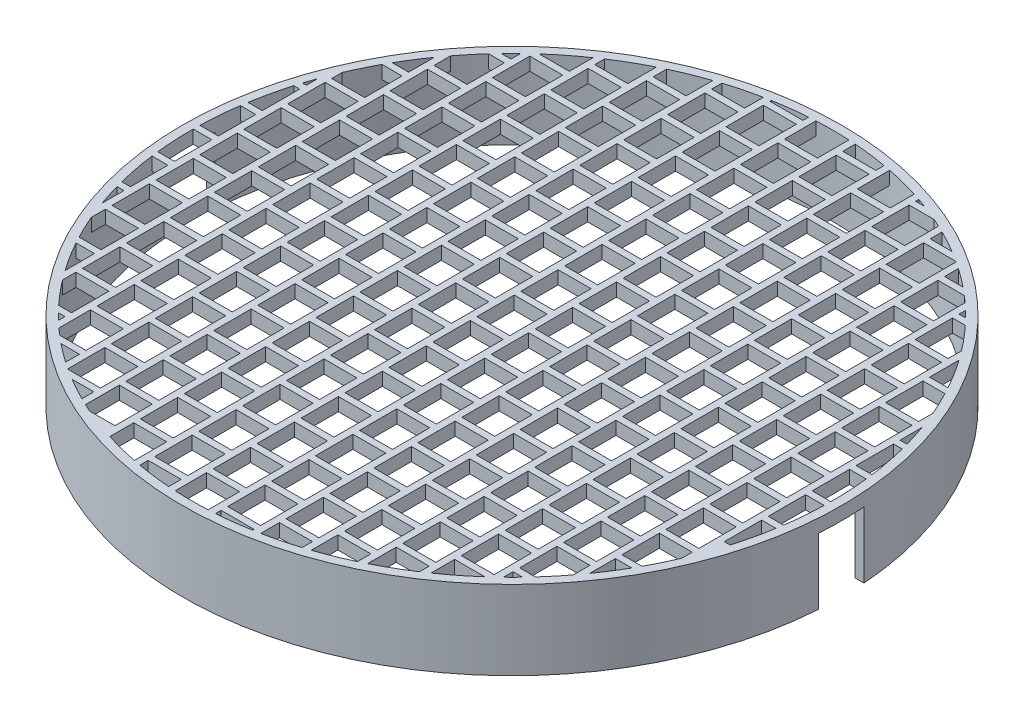
from build123d import *
from build123d.topology import SkipClean

# Parameters (mm, degrees)
BOSS_EXTRUDE1_DEPTH        = 15
BOSS_EXTRUDE1_DEPTH_BACK   = 3
BOSS_EXTRUDE1_2_DEPTH      = 15
BOSS_EXTRUDE1_2_DEPTH_BACK = 3
SKETCH2_R                  = 88.682492018
SKETCH2_W                  = 7.5
SKETCH2_H                  = 8.5
BOSS_EXTRUDE5_DEPTH        = 3
CUT_EXTRUDE1_DEPTH         = 127.701100157
CUT_EXTRUDE1_DEPTH_BACK    = 127.701100157
SKETCH3_R                  = 98.497493729
SKETCH3_R_2                = 75
BOSS_EXTRUDE6_START        = -3
BOSS_EXTRUDE6_DEPTH        = 3


with BuildPart() as part:
    # Sketch1 → Boss-Extrude1 (new, two sides: drawn at the far end of the back side and taken through both)
    with BuildSketch(Plane(origin=(0, 0, 0), x_dir=(1, 0, 0), z_dir=(0, 1, 0)).offset(-BOSS_EXTRUDE1_DEPTH_BACK)):
        with BuildLine():
            Line((72.8095066, 5.27027027), (74.814599185, 5.27027027))
            ThreePointArc((74.814599185, 5.27027027), (74.792407557, 5.57635829), (74.768963641, 5.882352941))
            ThreePointArc((74.768963641, 5.882352941), (0, 75), (-74.768963641, 5.882352941))
            ThreePointArc((-74.768963641, 5.882352941), (-74.792407557, 5.57635829), (-74.814599185, 5.27027027))
            Line((-74.814599185, 5.27027027), (-72.8095066, 5.27027027))
            ThreePointArc((-72.8095066, 5.27027027), (-72.785299957, 5.594650136), (-72.759648149, 5.918918919))
            ThreePointArc((-72.759648149, 5.918918919), (0, 73), (72.759648149, 5.918918919))
            ThreePointArc((72.759648149, 5.918918919), (72.785299957, 5.594650136), (72.8095066, 5.27027027))
        make_face()
    extrude(amount=BOSS_EXTRUDE1_DEPTH + BOSS_EXTRUDE1_DEPTH_BACK)



with BuildPart() as body_2:
    # Sketch1 → Boss-Extrude1 2 (new, two sides: drawn at the far end of the back side and taken through both)
    with BuildSketch(Plane(origin=(0, 0, 0), x_dir=(1, 0, 0), z_dir=(0, 1, 0)).offset(-BOSS_EXTRUDE1_2_DEPTH_BACK)):
        with BuildLine():
            Line((-74.824366839, -5.12972973), (-72.819543207, -5.12972973))
            ThreePointArc((-72.819543207, -5.12972973), (-72.790665225, -5.524405497), (-72.759648149, -5.918918919))
            ThreePointArc((-72.759648149, -5.918918919), (0, -73), (72.759648149, -5.918918919))
            ThreePointArc((72.759648149, -5.918918919), (72.790665225, -5.524405497), (72.819543207, -5.12972973))
            Line((72.819543207, -5.12972973), (74.824366839, -5.12972973))
            ThreePointArc((74.824366839, -5.12972973), (74.79761187, -5.50611102), (74.768963641, -5.882352941))
            ThreePointArc((74.768963641, -5.882352941), (0, -75), (-74.768963641, -5.882352941))
            ThreePointArc((-74.768963641, -5.882352941), (-74.79761187, -5.50611102), (-74.824366839, -5.12972973))
        make_face()
    extrude(amount=BOSS_EXTRUDE1_2_DEPTH + BOSS_EXTRUDE1_2_DEPTH_BACK)


with BuildPart() as part_1:
    add(part.part)

    add(body_2.part)  # Boss-Extrude5 merges body 2
    # Sketch2 → Boss-Extrude5 (add)
    with BuildSketch(Plane(origin=(0, 15, 0), x_dir=(1, 0, 0), z_dir=(0, 1, 0))):
        with Locations(Location((0, 0, 0), (0, 0, 270))):
            Circle(SKETCH2_R)
        Rectangle(SKETCH2_W, SKETCH2_H, mode=Mode.SUBTRACT)
        with Locations((9.06307787, 14.226182617)):
            Rectangle(SKETCH2_W, SKETCH2_H, mode=Mode.SUBTRACT)
        with Locations((18.126155741, 18.452365235)):
            Rectangle(SKETCH2_W, SKETCH2_H, mode=Mode.SUBTRACT)
        with Locations((27.189233611, 22.678547852)):
            Rectangle(SKETCH2_W, SKETCH2_H, mode=Mode.SUBTRACT)
        with Locations((36.252311481, 26.90473047)):
            Rectangle(SKETCH2_W, SKETCH2_H, mode=Mode.SUBTRACT)
        with Locations((45.315389352, 31.130913087)):
            Rectangle(SKETCH2_W, SKETCH2_H, mode=Mode.SUBTRACT)
        with Locations((54.378467222, 35.357095704)):
            Rectangle(SKETCH2_W, SKETCH2_H, mode=Mode.SUBTRACT)
        with Locations((63.441545093, 39.583278322)):
            Rectangle(SKETCH2_W, SKETCH2_H, mode=Mode.SUBTRACT)
        with Locations((9.06307787, 24.226182617)):
            Rectangle(SKETCH2_W, SKETCH2_H, mode=Mode.SUBTRACT)
        with Locations((18.126155741, 28.452365235)):
            Rectangle(SKETCH2_W, SKETCH2_H, mode=Mode.SUBTRACT)
        with Locations((27.189233611, 32.678547852)):
            Rectangle(SKETCH2_W, SKETCH2_H, mode=Mode.SUBTRACT)
        with Locations((36.252311481, 36.90473047)):
            Rectangle(SKETCH2_W, SKETCH2_H, mode=Mode.SUBTRACT)
        with Locations((45.315389352, 41.130913087)):
            Rectangle(SKETCH2_W, SKETCH2_H, mode=Mode.SUBTRACT)
        with Locations((54.378467222, 45.357095704)):
            Rectangle(SKETCH2_W, SKETCH2_H, mode=Mode.SUBTRACT)
        with Locations((9.06307787, 34.226182617)):
            Rectangle(SKETCH2_W, SKETCH2_H, mode=Mode.SUBTRACT)
        with Locations((18.126155741, 38.452365235)):
            Rectangle(SKETCH2_W, SKETCH2_H, mode=Mode.SUBTRACT)
        with Locations((27.189233611, 42.678547852)):
            Rectangle(SKETCH2_W, SKETCH2_H, mode=Mode.SUBTRACT)
        with Locations((36.252311481, 46.90473047)):
            Rectangle(SKETCH2_W, SKETCH2_H, mode=Mode.SUBTRACT)
        with Locations((45.315389352, 51.130913087)):
            Rectangle(SKETCH2_W, SKETCH2_H, mode=Mode.SUBTRACT)
        with Locations((54.378467222, 55.357095704)):
            Rectangle(SKETCH2_W, SKETCH2_H, mode=Mode.SUBTRACT)
        with Locations((9.06307787, 44.226182617)):
            Rectangle(SKETCH2_W, SKETCH2_H, mode=Mode.SUBTRACT)
        with Locations((18.126155741, 48.452365235)):
            Rectangle(SKETCH2_W, SKETCH2_H, mode=Mode.SUBTRACT)
        with Locations((27.189233611, 52.678547852)):
            Rectangle(SKETCH2_W, SKETCH2_H, mode=Mode.SUBTRACT)
        with Locations((36.252311481, 56.90473047)):
            Rectangle(SKETCH2_W, SKETCH2_H, mode=Mode.SUBTRACT)
        with Locations((45.315389352, 61.130913087)):
            Rectangle(SKETCH2_W, SKETCH2_H, mode=Mode.SUBTRACT)
        with Locations((9.06307787, 54.226182617)):
            Rectangle(SKETCH2_W, SKETCH2_H, mode=Mode.SUBTRACT)
        with Locations((18.126155741, 58.452365235)):
            Rectangle(SKETCH2_W, SKETCH2_H, mode=Mode.SUBTRACT)
        with Locations((27.189233611, 62.678547852)):
            Rectangle(SKETCH2_W, SKETCH2_H, mode=Mode.SUBTRACT)
        with Locations((36.252311481, 66.90473047)):
            Rectangle(SKETCH2_W, SKETCH2_H, mode=Mode.SUBTRACT)
        with Locations((9.06307787, 64.226182617)):
            Rectangle(SKETCH2_W, SKETCH2_H, mode=Mode.SUBTRACT)
        with Locations((18.126155741, 68.452365235)):
            Rectangle(SKETCH2_W, SKETCH2_H, mode=Mode.SUBTRACT)
        with Locations((27.189233611, 72.678547852)):
            Rectangle(SKETCH2_W, SKETCH2_H, mode=Mode.SUBTRACT)
        with Locations((9.06307787, 74.226182617)):
            Rectangle(SKETCH2_W, SKETCH2_H, mode=Mode.SUBTRACT)
        with Locations((9.06307787, 4.226182617)):
            Rectangle(SKETCH2_W, SKETCH2_H, mode=Mode.SUBTRACT)
        with Locations((18.126155741, 8.452365235)):
            Rectangle(SKETCH2_W, SKETCH2_H, mode=Mode.SUBTRACT)
        with Locations((27.189233611, 12.678547852)):
            Rectangle(SKETCH2_W, SKETCH2_H, mode=Mode.SUBTRACT)
        with Locations((36.252311481, 16.90473047)):
            Rectangle(SKETCH2_W, SKETCH2_H, mode=Mode.SUBTRACT)
        with Locations((45.315389352, 21.130913087)):
            Rectangle(SKETCH2_W, SKETCH2_H, mode=Mode.SUBTRACT)
        with Locations((54.378467222, 25.357095704)):
            Rectangle(SKETCH2_W, SKETCH2_H, mode=Mode.SUBTRACT)
        with Locations((63.441545093, 29.583278322)):
            Rectangle(SKETCH2_W, SKETCH2_H, mode=Mode.SUBTRACT)
        with Locations((9.06307787, -5.773817383)):
            Rectangle(SKETCH2_W, SKETCH2_H, mode=Mode.SUBTRACT)
        with Locations((18.126155741, -1.547634765)):
            Rectangle(SKETCH2_W, SKETCH2_H, mode=Mode.SUBTRACT)
        with Locations((27.189233611, 2.678547852)):
            Rectangle(SKETCH2_W, SKETCH2_H, mode=Mode.SUBTRACT)
        with Locations((36.252311481, 6.90473047)):
            Rectangle(SKETCH2_W, SKETCH2_H, mode=Mode.SUBTRACT)
        with Locations((45.315389352, 11.130913087)):
            Rectangle(SKETCH2_W, SKETCH2_H, mode=Mode.SUBTRACT)
        with Locations((54.378467222, 15.357095704)):
            Rectangle(SKETCH2_W, SKETCH2_H, mode=Mode.SUBTRACT)
        with Locations((63.441545093, 19.583278322)):
            Rectangle(SKETCH2_W, SKETCH2_H, mode=Mode.SUBTRACT)
        with Locations((72.504622963, 23.809460939)):
            Rectangle(SKETCH2_W, SKETCH2_H, mode=Mode.SUBTRACT)
        with Locations((9.06307787, -15.773817383)):
            Rectangle(SKETCH2_W, SKETCH2_H, mode=Mode.SUBTRACT)
        with Locations((18.126155741, -11.547634765)):
            Rectangle(SKETCH2_W, SKETCH2_H, mode=Mode.SUBTRACT)
        with Locations((27.189233611, -7.321452148)):
            Rectangle(SKETCH2_W, SKETCH2_H, mode=Mode.SUBTRACT)
        with Locations((36.252311481, -3.09526953)):
            Rectangle(SKETCH2_W, SKETCH2_H, mode=Mode.SUBTRACT)
        with Locations((45.315389352, 1.130913087)):
            Rectangle(SKETCH2_W, SKETCH2_H, mode=Mode.SUBTRACT)
        with Locations((54.378467222, 5.357095704)):
            Rectangle(SKETCH2_W, SKETCH2_H, mode=Mode.SUBTRACT)
        with Locations((63.441545093, 9.583278322)):
            Rectangle(SKETCH2_W, SKETCH2_H, mode=Mode.SUBTRACT)
        with Locations((72.504622963, 13.809460939)):
            Rectangle(SKETCH2_W, SKETCH2_H, mode=Mode.SUBTRACT)
        with Locations((9.06307787, -25.773817383)):
            Rectangle(SKETCH2_W, SKETCH2_H, mode=Mode.SUBTRACT)
        with Locations((18.126155741, -21.547634765)):
            Rectangle(SKETCH2_W, SKETCH2_H, mode=Mode.SUBTRACT)
        with Locations((27.189233611, -17.321452148)):
            Rectangle(SKETCH2_W, SKETCH2_H, mode=Mode.SUBTRACT)
        with Locations((36.252311481, -13.09526953)):
            Rectangle(SKETCH2_W, SKETCH2_H, mode=Mode.SUBTRACT)
        with Locations((45.315389352, -8.869086913)):
            Rectangle(SKETCH2_W, SKETCH2_H, mode=Mode.SUBTRACT)
        with Locations((54.378467222, -4.642904296)):
            Rectangle(SKETCH2_W, SKETCH2_H, mode=Mode.SUBTRACT)
        with Locations((63.441545093, -0.416721678)):
            Rectangle(SKETCH2_W, SKETCH2_H, mode=Mode.SUBTRACT)
        with Locations((72.504622963, 3.809460939)):
            Rectangle(SKETCH2_W, SKETCH2_H, mode=Mode.SUBTRACT)
        with Locations((9.06307787, -35.773817383)):
            Rectangle(SKETCH2_W, SKETCH2_H, mode=Mode.SUBTRACT)
        with Locations((18.126155741, -31.547634765)):
            Rectangle(SKETCH2_W, SKETCH2_H, mode=Mode.SUBTRACT)
        with Locations((27.189233611, -27.321452148)):
            Rectangle(SKETCH2_W, SKETCH2_H, mode=Mode.SUBTRACT)
        with Locations((36.252311481, -23.09526953)):
            Rectangle(SKETCH2_W, SKETCH2_H, mode=Mode.SUBTRACT)
        with Locations((45.315389352, -18.869086913)):
            Rectangle(SKETCH2_W, SKETCH2_H, mode=Mode.SUBTRACT)
        with Locations((54.378467222, -14.642904296)):
            Rectangle(SKETCH2_W, SKETCH2_H, mode=Mode.SUBTRACT)
        with Locations((63.441545093, -10.416721678)):
            Rectangle(SKETCH2_W, SKETCH2_H, mode=Mode.SUBTRACT)
        with Locations((72.504622963, -6.190539061)):
            Rectangle(SKETCH2_W, SKETCH2_H, mode=Mode.SUBTRACT)
        with Locations((9.06307787, -45.773817383)):
            Rectangle(SKETCH2_W, SKETCH2_H, mode=Mode.SUBTRACT)
        with Locations((18.126155741, -41.547634765)):
            Rectangle(SKETCH2_W, SKETCH2_H, mode=Mode.SUBTRACT)
        with Locations((27.189233611, -37.321452148)):
            Rectangle(SKETCH2_W, SKETCH2_H, mode=Mode.SUBTRACT)
        with Locations((36.252311481, -33.09526953)):
            Rectangle(SKETCH2_W, SKETCH2_H, mode=Mode.SUBTRACT)
        with Locations((45.315389352, -28.869086913)):
            Rectangle(SKETCH2_W, SKETCH2_H, mode=Mode.SUBTRACT)
        with Locations((54.378467222, -24.642904296)):
            Rectangle(SKETCH2_W, SKETCH2_H, mode=Mode.SUBTRACT)
        with Locations((63.441545093, -20.416721678)):
            Rectangle(SKETCH2_W, SKETCH2_H, mode=Mode.SUBTRACT)
        with Locations((72.504622963, -16.190539061)):
            Rectangle(SKETCH2_W, SKETCH2_H, mode=Mode.SUBTRACT)
        with Locations((9.06307787, -55.773817383)):
            Rectangle(SKETCH2_W, SKETCH2_H, mode=Mode.SUBTRACT)
        with Locations((18.126155741, -51.547634765)):
            Rectangle(SKETCH2_W, SKETCH2_H, mode=Mode.SUBTRACT)
        with Locations((27.189233611, -47.321452148)):
            Rectangle(SKETCH2_W, SKETCH2_H, mode=Mode.SUBTRACT)
        with Locations((36.252311481, -43.09526953)):
            Rectangle(SKETCH2_W, SKETCH2_H, mode=Mode.SUBTRACT)
        with Locations((45.315389352, -38.869086913)):
            Rectangle(SKETCH2_W, SKETCH2_H, mode=Mode.SUBTRACT)
        with Locations((54.378467222, -34.642904296)):
            Rectangle(SKETCH2_W, SKETCH2_H, mode=Mode.SUBTRACT)
        with Locations((63.441545093, -30.416721678)):
            Rectangle(SKETCH2_W, SKETCH2_H, mode=Mode.SUBTRACT)
        with Locations((9.06307787, -65.773817383)):
            Rectangle(SKETCH2_W, SKETCH2_H, mode=Mode.SUBTRACT)
        with Locations((18.126155741, -61.547634765)):
            Rectangle(SKETCH2_W, SKETCH2_H, mode=Mode.SUBTRACT)
        with Locations((27.189233611, -57.321452148)):
            Rectangle(SKETCH2_W, SKETCH2_H, mode=Mode.SUBTRACT)
        with Locations((36.252311481, -53.09526953)):
            Rectangle(SKETCH2_W, SKETCH2_H, mode=Mode.SUBTRACT)
        with Locations((45.315389352, -48.869086913)):
            Rectangle(SKETCH2_W, SKETCH2_H, mode=Mode.SUBTRACT)
        with Locations((54.378467222, -44.642904296)):
            Rectangle(SKETCH2_W, SKETCH2_H, mode=Mode.SUBTRACT)
        with Locations((63.441545093, -40.416721678)):
            Rectangle(SKETCH2_W, SKETCH2_H, mode=Mode.SUBTRACT)
        with Locations((9.06307787, -75.773817383)):
            Rectangle(SKETCH2_W, SKETCH2_H, mode=Mode.SUBTRACT)
        with Locations((18.126155741, -71.547634765)):
            Rectangle(SKETCH2_W, SKETCH2_H, mode=Mode.SUBTRACT)
        with Locations((27.189233611, -67.321452148)):
            Rectangle(SKETCH2_W, SKETCH2_H, mode=Mode.SUBTRACT)
        with Locations((36.252311481, -63.09526953)):
            Rectangle(SKETCH2_W, SKETCH2_H, mode=Mode.SUBTRACT)
        with Locations((45.315389352, -58.869086913)):
            Rectangle(SKETCH2_W, SKETCH2_H, mode=Mode.SUBTRACT)
        with Locations((54.378467222, -54.642904296)):
            Rectangle(SKETCH2_W, SKETCH2_H, mode=Mode.SUBTRACT)
        with Locations((-9.06307787, 5.773817383)):
            Rectangle(SKETCH2_W, SKETCH2_H, mode=Mode.SUBTRACT)
        with Locations((-18.126155741, 1.547634765)):
            Rectangle(SKETCH2_W, SKETCH2_H, mode=Mode.SUBTRACT)
        with Locations((-27.189233611, -2.678547852)):
            Rectangle(SKETCH2_W, SKETCH2_H, mode=Mode.SUBTRACT)
        with Locations((-36.252311481, -6.90473047)):
            Rectangle(SKETCH2_W, SKETCH2_H, mode=Mode.SUBTRACT)
        with Locations((-45.315389352, -11.130913087)):
            Rectangle(SKETCH2_W, SKETCH2_H, mode=Mode.SUBTRACT)
        with Locations((-54.378467222, -15.357095704)):
            Rectangle(SKETCH2_W, SKETCH2_H, mode=Mode.SUBTRACT)
        with Locations((-63.441545093, -19.583278322)):
            Rectangle(SKETCH2_W, SKETCH2_H, mode=Mode.SUBTRACT)
        with Locations((-72.504622963, -23.809460939)):
            Rectangle(SKETCH2_W, SKETCH2_H, mode=Mode.SUBTRACT)
        with Locations((-9.06307787, 15.773817383)):
            Rectangle(SKETCH2_W, SKETCH2_H, mode=Mode.SUBTRACT)
        with Locations((-18.126155741, 11.547634765)):
            Rectangle(SKETCH2_W, SKETCH2_H, mode=Mode.SUBTRACT)
        with Locations((-27.189233611, 7.321452148)):
            Rectangle(SKETCH2_W, SKETCH2_H, mode=Mode.SUBTRACT)
        with Locations((-36.252311481, 3.09526953)):
            Rectangle(SKETCH2_W, SKETCH2_H, mode=Mode.SUBTRACT)
        with Locations((-45.315389352, -1.130913087)):
            Rectangle(SKETCH2_W, SKETCH2_H, mode=Mode.SUBTRACT)
        with Locations((-54.378467222, -5.357095704)):
            Rectangle(SKETCH2_W, SKETCH2_H, mode=Mode.SUBTRACT)
        with Locations((-63.441545093, -9.583278322)):
            Rectangle(SKETCH2_W, SKETCH2_H, mode=Mode.SUBTRACT)
        with Locations((-72.504622963, -13.809460939)):
            Rectangle(SKETCH2_W, SKETCH2_H, mode=Mode.SUBTRACT)
        with Locations((-9.06307787, 25.773817383)):
            Rectangle(SKETCH2_W, SKETCH2_H, mode=Mode.SUBTRACT)
        with Locations((-18.126155741, 21.547634765)):
            Rectangle(SKETCH2_W, SKETCH2_H, mode=Mode.SUBTRACT)
        with Locations((-27.189233611, 17.321452148)):
            Rectangle(SKETCH2_W, SKETCH2_H, mode=Mode.SUBTRACT)
        with Locations((-36.252311481, 13.09526953)):
            Rectangle(SKETCH2_W, SKETCH2_H, mode=Mode.SUBTRACT)
        with Locations((-45.315389352, 8.869086913)):
            Rectangle(SKETCH2_W, SKETCH2_H, mode=Mode.SUBTRACT)
        with Locations((-54.378467222, 4.642904296)):
            Rectangle(SKETCH2_W, SKETCH2_H, mode=Mode.SUBTRACT)
        with Locations((-63.441545093, 0.416721678)):
            Rectangle(SKETCH2_W, SKETCH2_H, mode=Mode.SUBTRACT)
        with Locations((-72.504622963, -3.809460939)):
            Rectangle(SKETCH2_W, SKETCH2_H, mode=Mode.SUBTRACT)
        with Locations((-9.06307787, 35.773817383)):
            Rectangle(SKETCH2_W, SKETCH2_H, mode=Mode.SUBTRACT)
        with Locations((-18.126155741, 31.547634765)):
            Rectangle(SKETCH2_W, SKETCH2_H, mode=Mode.SUBTRACT)
        with Locations((-27.189233611, 27.321452148)):
            Rectangle(SKETCH2_W, SKETCH2_H, mode=Mode.SUBTRACT)
        with Locations((-36.252311481, 23.09526953)):
            Rectangle(SKETCH2_W, SKETCH2_H, mode=Mode.SUBTRACT)
        with Locations((-45.315389352, 18.869086913)):
            Rectangle(SKETCH2_W, SKETCH2_H, mode=Mode.SUBTRACT)
        with Locations((-54.378467222, 14.642904296)):
            Rectangle(SKETCH2_W, SKETCH2_H, mode=Mode.SUBTRACT)
        with Locations((-63.441545093, 10.416721678)):
            Rectangle(SKETCH2_W, SKETCH2_H, mode=Mode.SUBTRACT)
        with Locations((-72.504622963, 6.190539061)):
            Rectangle(SKETCH2_W, SKETCH2_H, mode=Mode.SUBTRACT)
        with Locations((-9.06307787, 45.773817383)):
            Rectangle(SKETCH2_W, SKETCH2_H, mode=Mode.SUBTRACT)
        with Locations((-18.126155741, 41.547634765)):
            Rectangle(SKETCH2_W, SKETCH2_H, mode=Mode.SUBTRACT)
        with Locations((-27.189233611, 37.321452148)):
            Rectangle(SKETCH2_W, SKETCH2_H, mode=Mode.SUBTRACT)
        with Locations((-36.252311481, 33.09526953)):
            Rectangle(SKETCH2_W, SKETCH2_H, mode=Mode.SUBTRACT)
        with Locations((-45.315389352, 28.869086913)):
            Rectangle(SKETCH2_W, SKETCH2_H, mode=Mode.SUBTRACT)
        with Locations((-54.378467222, 24.642904296)):
            Rectangle(SKETCH2_W, SKETCH2_H, mode=Mode.SUBTRACT)
        with Locations((-63.441545093, 20.416721678)):
            Rectangle(SKETCH2_W, SKETCH2_H, mode=Mode.SUBTRACT)
        with Locations((-72.504622963, 16.190539061)):
            Rectangle(SKETCH2_W, SKETCH2_H, mode=Mode.SUBTRACT)
        with Locations((-9.06307787, 55.773817383)):
            Rectangle(SKETCH2_W, SKETCH2_H, mode=Mode.SUBTRACT)
        with Locations((-18.126155741, 51.547634765)):
            Rectangle(SKETCH2_W, SKETCH2_H, mode=Mode.SUBTRACT)
        with Locations((-27.189233611, 47.321452148)):
            Rectangle(SKETCH2_W, SKETCH2_H, mode=Mode.SUBTRACT)
        with Locations((-36.252311481, 43.09526953)):
            Rectangle(SKETCH2_W, SKETCH2_H, mode=Mode.SUBTRACT)
        with Locations((-45.315389352, 38.869086913)):
            Rectangle(SKETCH2_W, SKETCH2_H, mode=Mode.SUBTRACT)
        with Locations((-54.378467222, 34.642904296)):
            Rectangle(SKETCH2_W, SKETCH2_H, mode=Mode.SUBTRACT)
        with Locations((-63.441545093, 30.416721678)):
            Rectangle(SKETCH2_W, SKETCH2_H, mode=Mode.SUBTRACT)
        with Locations((-72.504622963, 26.190539061)):
            Rectangle(SKETCH2_W, SKETCH2_H, mode=Mode.SUBTRACT)
        with Locations((-9.06307787, 65.773817383)):
            Rectangle(SKETCH2_W, SKETCH2_H, mode=Mode.SUBTRACT)
        with Locations((-18.126155741, 61.547634765)):
            Rectangle(SKETCH2_W, SKETCH2_H, mode=Mode.SUBTRACT)
        with Locations((-27.189233611, 57.321452148)):
            Rectangle(SKETCH2_W, SKETCH2_H, mode=Mode.SUBTRACT)
        with Locations((-36.252311481, 53.09526953)):
            Rectangle(SKETCH2_W, SKETCH2_H, mode=Mode.SUBTRACT)
        with Locations((-45.315389352, 48.869086913)):
            Rectangle(SKETCH2_W, SKETCH2_H, mode=Mode.SUBTRACT)
        with Locations((-54.378467222, 44.642904296)):
            Rectangle(SKETCH2_W, SKETCH2_H, mode=Mode.SUBTRACT)
        with Locations((-63.441545093, 40.416721678)):
            Rectangle(SKETCH2_W, SKETCH2_H, mode=Mode.SUBTRACT)
        with Locations((-9.06307787, 75.773817383)):
            Rectangle(SKETCH2_W, SKETCH2_H, mode=Mode.SUBTRACT)
        with Locations((-18.126155741, 71.547634765)):
            Rectangle(SKETCH2_W, SKETCH2_H, mode=Mode.SUBTRACT)
        with Locations((-27.189233611, 67.321452148)):
            Rectangle(SKETCH2_W, SKETCH2_H, mode=Mode.SUBTRACT)
        with Locations((-36.252311481, 63.09526953)):
            Rectangle(SKETCH2_W, SKETCH2_H, mode=Mode.SUBTRACT)
        with Locations((-45.315389352, 58.869086913)):
            Rectangle(SKETCH2_W, SKETCH2_H, mode=Mode.SUBTRACT)
        with Locations((-54.378467222, 54.642904296)):
            Rectangle(SKETCH2_W, SKETCH2_H, mode=Mode.SUBTRACT)
        with Locations((0, 10)):
            Rectangle(SKETCH2_W, SKETCH2_H, mode=Mode.SUBTRACT)
        with Locations((0, 20)):
            Rectangle(SKETCH2_W, SKETCH2_H, mode=Mode.SUBTRACT)
        with Locations((0, 30)):
            Rectangle(SKETCH2_W, SKETCH2_H, mode=Mode.SUBTRACT)
        with Locations((0, 40)):
            Rectangle(SKETCH2_W, SKETCH2_H, mode=Mode.SUBTRACT)
        with Locations((0, 50)):
            Rectangle(SKETCH2_W, SKETCH2_H, mode=Mode.SUBTRACT)
        with Locations((0, 60)):
            Rectangle(SKETCH2_W, SKETCH2_H, mode=Mode.SUBTRACT)
        with Locations((0, 70)):
            Rectangle(SKETCH2_W, SKETCH2_H, mode=Mode.SUBTRACT)
        with Locations((-9.06307787, -4.226182617)):
            Rectangle(SKETCH2_W, SKETCH2_H, mode=Mode.SUBTRACT)
        with Locations((-18.126155741, -8.452365235)):
            Rectangle(SKETCH2_W, SKETCH2_H, mode=Mode.SUBTRACT)
        with Locations((-27.189233611, -12.678547852)):
            Rectangle(SKETCH2_W, SKETCH2_H, mode=Mode.SUBTRACT)
        with Locations((-36.252311481, -16.90473047)):
            Rectangle(SKETCH2_W, SKETCH2_H, mode=Mode.SUBTRACT)
        with Locations((-45.315389352, -21.130913087)):
            Rectangle(SKETCH2_W, SKETCH2_H, mode=Mode.SUBTRACT)
        with Locations((-54.378467222, -25.357095704)):
            Rectangle(SKETCH2_W, SKETCH2_H, mode=Mode.SUBTRACT)
        with Locations((-63.441545092, -29.583278322)):
            Rectangle(SKETCH2_W, SKETCH2_H, mode=Mode.SUBTRACT)
        with Locations((-9.06307787, -14.226182617)):
            Rectangle(SKETCH2_W, SKETCH2_H, mode=Mode.SUBTRACT)
        with Locations((-18.126155741, -18.452365235)):
            Rectangle(SKETCH2_W, SKETCH2_H, mode=Mode.SUBTRACT)
        with Locations((-27.189233611, -22.678547852)):
            Rectangle(SKETCH2_W, SKETCH2_H, mode=Mode.SUBTRACT)
        with Locations((-36.252311481, -26.90473047)):
            Rectangle(SKETCH2_W, SKETCH2_H, mode=Mode.SUBTRACT)
        with Locations((-45.315389352, -31.130913087)):
            Rectangle(SKETCH2_W, SKETCH2_H, mode=Mode.SUBTRACT)
        with Locations((-54.378467222, -35.357095704)):
            Rectangle(SKETCH2_W, SKETCH2_H, mode=Mode.SUBTRACT)
        with Locations((-63.441545092, -39.583278322)):
            Rectangle(SKETCH2_W, SKETCH2_H, mode=Mode.SUBTRACT)
        with Locations((-9.06307787, -24.226182617)):
            Rectangle(SKETCH2_W, SKETCH2_H, mode=Mode.SUBTRACT)
        with Locations((-18.126155741, -28.452365235)):
            Rectangle(SKETCH2_W, SKETCH2_H, mode=Mode.SUBTRACT)
        with Locations((-27.189233611, -32.678547852)):
            Rectangle(SKETCH2_W, SKETCH2_H, mode=Mode.SUBTRACT)
        with Locations((-36.252311481, -36.90473047)):
            Rectangle(SKETCH2_W, SKETCH2_H, mode=Mode.SUBTRACT)
        with Locations((-45.315389352, -41.130913087)):
            Rectangle(SKETCH2_W, SKETCH2_H, mode=Mode.SUBTRACT)
        with Locations((-54.378467222, -45.357095704)):
            Rectangle(SKETCH2_W, SKETCH2_H, mode=Mode.SUBTRACT)
        with Locations((-9.06307787, -34.226182617)):
            Rectangle(SKETCH2_W, SKETCH2_H, mode=Mode.SUBTRACT)
        with Locations((-18.126155741, -38.452365235)):
            Rectangle(SKETCH2_W, SKETCH2_H, mode=Mode.SUBTRACT)
        with Locations((-27.189233611, -42.678547852)):
            Rectangle(SKETCH2_W, SKETCH2_H, mode=Mode.SUBTRACT)
        with Locations((-36.252311481, -46.904730469)):
            Rectangle(SKETCH2_W, SKETCH2_H, mode=Mode.SUBTRACT)
        with Locations((-45.315389352, -51.130913087)):
            Rectangle(SKETCH2_W, SKETCH2_H, mode=Mode.SUBTRACT)
        with Locations((-54.378467222, -55.357095704)):
            Rectangle(SKETCH2_W, SKETCH2_H, mode=Mode.SUBTRACT)
        with Locations((-9.06307787, -44.226182617)):
            Rectangle(SKETCH2_W, SKETCH2_H, mode=Mode.SUBTRACT)
        with Locations((-18.126155741, -48.452365235)):
            Rectangle(SKETCH2_W, SKETCH2_H, mode=Mode.SUBTRACT)
        with Locations((-27.189233611, -52.678547852)):
            Rectangle(SKETCH2_W, SKETCH2_H, mode=Mode.SUBTRACT)
        with Locations((-36.252311481, -56.904730469)):
            Rectangle(SKETCH2_W, SKETCH2_H, mode=Mode.SUBTRACT)
        with Locations((-45.315389352, -61.130913087)):
            Rectangle(SKETCH2_W, SKETCH2_H, mode=Mode.SUBTRACT)
        with Locations((-9.06307787, -54.226182617)):
            Rectangle(SKETCH2_W, SKETCH2_H, mode=Mode.SUBTRACT)
        with Locations((-18.126155741, -58.452365235)):
            Rectangle(SKETCH2_W, SKETCH2_H, mode=Mode.SUBTRACT)
        with Locations((-27.189233611, -62.678547852)):
            Rectangle(SKETCH2_W, SKETCH2_H, mode=Mode.SUBTRACT)
        with Locations((-36.252311481, -66.904730469)):
            Rectangle(SKETCH2_W, SKETCH2_H, mode=Mode.SUBTRACT)
        with Locations((-9.06307787, -64.226182617)):
            Rectangle(SKETCH2_W, SKETCH2_H, mode=Mode.SUBTRACT)
        with Locations((-18.126155741, -68.452365235)):
            Rectangle(SKETCH2_W, SKETCH2_H, mode=Mode.SUBTRACT)
        with Locations((-9.06307787, -74.226182617)):
            Rectangle(SKETCH2_W, SKETCH2_H, mode=Mode.SUBTRACT)
        with Locations((0, -10)):
            Rectangle(SKETCH2_W, SKETCH2_H, mode=Mode.SUBTRACT)
        with Locations((0, -20)):
            Rectangle(SKETCH2_W, SKETCH2_H, mode=Mode.SUBTRACT)
        with Locations((0, -30)):
            Rectangle(SKETCH2_W, SKETCH2_H, mode=Mode.SUBTRACT)
        with Locations((0, -40)):
            Rectangle(SKETCH2_W, SKETCH2_H, mode=Mode.SUBTRACT)
        with Locations((0, -50)):
            Rectangle(SKETCH2_W, SKETCH2_H, mode=Mode.SUBTRACT)
        with Locations((0, -60)):
            Rectangle(SKETCH2_W, SKETCH2_H, mode=Mode.SUBTRACT)
        with Locations((0, -70)):
            Rectangle(SKETCH2_W, SKETCH2_H, mode=Mode.SUBTRACT)
    extrude(amount=-BOSS_EXTRUDE5_DEPTH)

    # Sketch3 → Cut-Extrude1 (cut, two sides: drawn at the far end of the back side and taken through both)
    with BuildSketch(Plane.XZ.offset(3).offset(-CUT_EXTRUDE1_DEPTH_BACK)):
        Circle(SKETCH3_R)
        Circle(SKETCH3_R_2, mode=Mode.SUBTRACT)
    extrude(amount=CUT_EXTRUDE1_DEPTH + CUT_EXTRUDE1_DEPTH_BACK, mode=Mode.SUBTRACT)

    # Sketch4 → Boss-Extrude6 (add)
    with SkipClean():  # the faces are left unmerged after this step: merging them gives an invalid solid
        with BuildSketch(Plane(origin=(0, 15, 0), x_dir=(1, 0, 0), z_dir=(0, 1, 0)).offset(BOSS_EXTRUDE6_START)):
            with BuildLine():
                Line((-74.766077862, 5.918918919), (-72.759648149, 5.918918919))
                ThreePointArc((-72.759648149, 5.918918919), (-73, 0), (-72.759648149, -5.918918919))
                Line((-72.759648149, -5.918918919), (-74.766077862, -5.918918919))
                ThreePointArc((-74.766077862, -5.918918919), (-75, 0), (-74.766077862, 5.918918919))
            make_face()
            with BuildLine():
                Line((74.766077862, -5.918918919), (72.759648149, -5.918918919))
                ThreePointArc((72.759648149, -5.918918919), (73, 0), (72.759648149, 5.918918919))
                Line((72.759648149, 5.918918919), (74.766077862, 5.918918919))
                ThreePointArc((74.766077862, 5.918918919), (75, 0), (74.766077862, -5.918918919))
            make_face()
        extrude(amount=BOSS_EXTRUDE6_DEPTH)


solid = part_1.part
